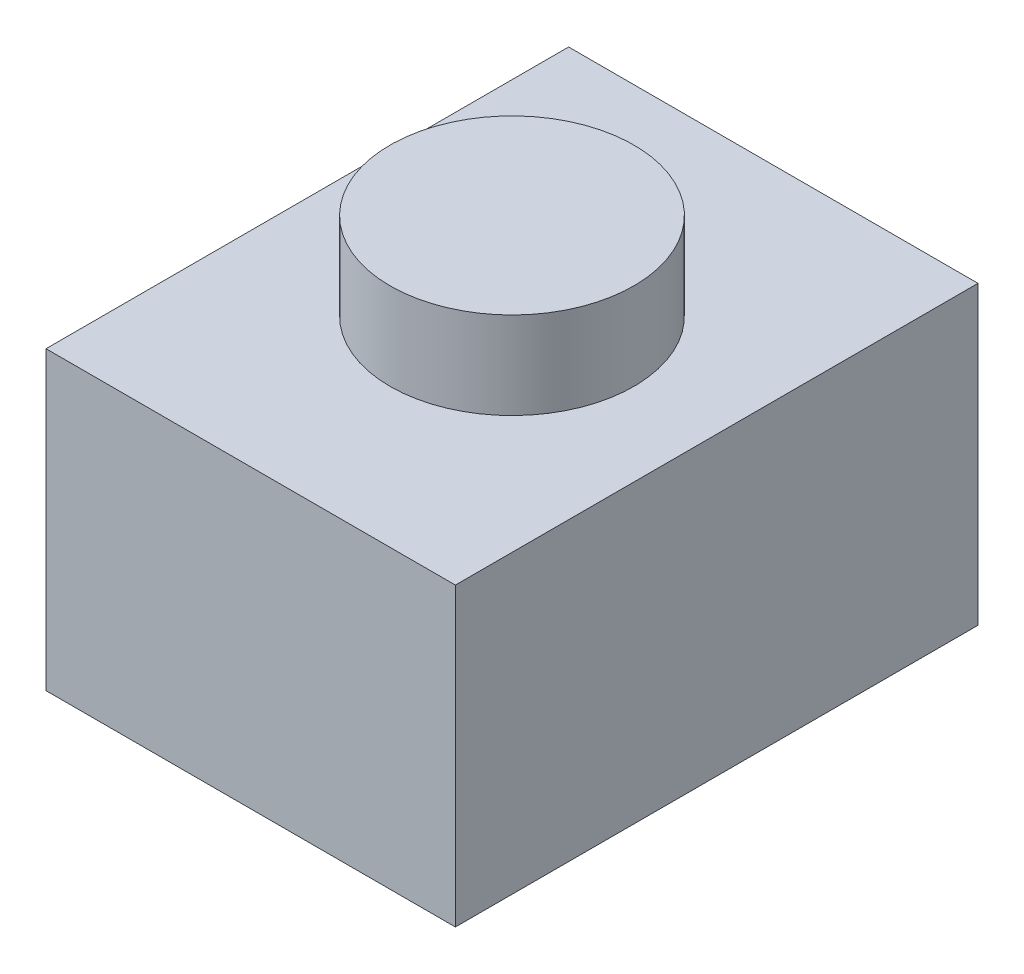
from build123d import *

# Parameters (mm, degrees)
SKETCH1_W           = 5.969
SKETCH1_H           = 7.62
BOSS_EXTRUDE1_DEPTH = 4.318
SKETCH2_R           = 1.778
BOSS_EXTRUDE2_DEPTH = 1.27


with BuildPart() as part:
    # Sketch1 → Boss-Extrude1 (new body)
    with BuildSketch(Plane(origin=(0, 0, 0), x_dir=(1, 0, 0), z_dir=(0, 1, 0))):
        Rectangle(SKETCH1_W, SKETCH1_H)
    extrude(amount=BOSS_EXTRUDE1_DEPTH)

    # Sketch2 → Boss-Extrude2 (add)
    with BuildSketch(Plane(origin=(0, 4.318, 0), x_dir=(1, 0, 0), z_dir=(0, 1, 0))):
        Circle(SKETCH2_R)
    extrude(amount=BOSS_EXTRUDE2_DEPTH)


solid = part.part
